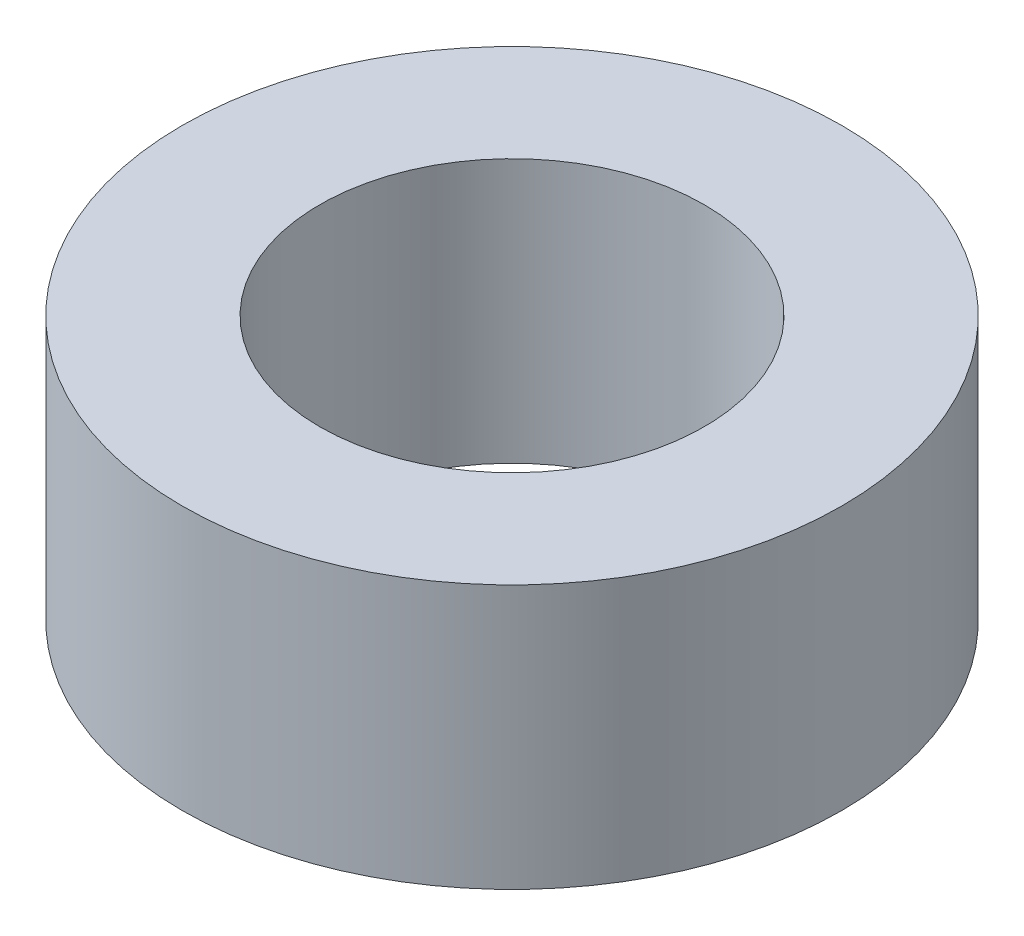
from build123d import *

# Parameters (mm, degrees)
SKETCH1_R           = 30
BOSS_EXTRUDE1_DEPTH = 24
SKETCH2_R           = 17.5
CUT_EXTRUDE1_DEPTH  = 49.744230428


with BuildPart() as part:
    # Sketch1 → Boss-Extrude1 (new body)
    with BuildSketch(Plane(origin=(0, 0, 0), x_dir=(1, 0, 0), z_dir=(0, 1, 0))):
        Circle(SKETCH1_R)
    extrude(amount=BOSS_EXTRUDE1_DEPTH)

    # Sketch2 → Cut-Extrude1 (cut, through all)
    with BuildSketch(Plane(origin=(0, 0, 0), x_dir=(1, 0, 0), z_dir=(0, 1, 0))):
        Circle(SKETCH2_R)
    extrude(amount=CUT_EXTRUDE1_DEPTH, mode=Mode.SUBTRACT)


solid = part.part
